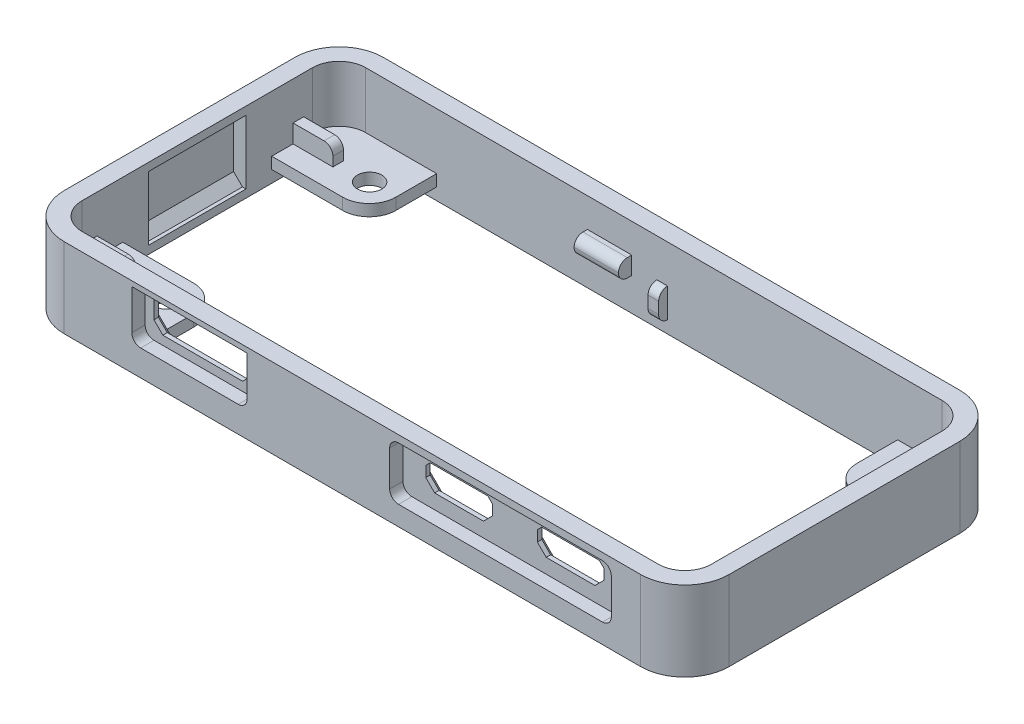
from build123d import *

# Parameters (mm, degrees)
EXTRUDE_1_DEPTH          = 7
EXTRUDE_1_DEPTH_BACK     = 2
CUT_EXTRUDE_2_DEPTH      = 44.557928135
CUT_EXTRUDE_2_DEPTH_BACK = 44.557928135
RIB_START                = -0.65
RIB_1_DEPTH              = 1.3
RIB_2_DEPTH              = 1.3
RIB_3_DEPTH              = 1.3
RIB_4_DEPTH              = 1.3
CUT_EXTRUDE_5_DEPTH      = 40
CUT_EXTRUDE_5_DEPTH_BACK = 40
SKETCH_18_R              = 1.375
SKETCH_41_W              = 13
SKETCH_41_H              = 5.5
CUT_EXTRUDE_14_DEPTH     = 1.5
SKETCH_53_W              = 1.2
SKETCH_53_H              = 3.3
EXTRUDE_15_DEPTH         = 1
FILLET_20_R              = 1
SKETCH_55_W              = 1.2
SKETCH_55_H              = 3.3
EXTRUDE_17_DEPTH         = 1.4
SKETCH_54_W              = 1.2
SKETCH_54_H              = 3.3
EXTRUDE_18_DEPTH         = 4.5
FILLET_22_R              = 1
SKETCH_59_W              = 11
SKETCH_59_H              = 7.2
CUT_EXTRUDE_24_DEPTH     = 1.4
CHAMFER_5_SIZE           = 1
SKETCH_63_W              = 1.2
SKETCH_63_H              = 3.3
EXTRUDE_21_DEPTH         = 4.5
FILLET_27_R              = 1
SKETCH_64_W              = 1.2
SKETCH_64_H              = 3.3
EXTRUDE_22_DEPTH         = 1.4
FILLET_28_R              = 1
SKETCH_65_W              = 1.2
SKETCH_65_H              = 3.3
EXTRUDE_23_DEPTH         = 0.9
FILLET_29_R              = 1
SKETCH_66_W              = 15
SKETCH_66_H              = 7.2
CUT_EXTRUDE_26_DEPTH     = 1.5
CHAMFER_10_SIZE          = 1
SKETCH_70_W              = 5
SKETCH_70_H              = 1.2
EXTRUDE_24_DEPTH         = 1.5
FILLET_31_R              = 1
SKETCH_71_W              = 5
SKETCH_71_H              = 2
EXTRUDE_25_DEPTH         = 1.5
FILLET_32_R              = 1
SKETCH_42_W              = 11
SKETCH_42_H              = 3.5
CUT_EXTRUDE_15_DEPTH     = 2.4
FILLET_33_R              = 1
SKETCH_74_W              = 16
SKETCH_74_H              = 6
EXTRUDE_26_DEPTH         = 0.5
CUT_EXTRUDE_29_REACH     = 55.566
SKETCH_46_W              = 11
SKETCH_46_H              = 3.5
CHAMFER_13_SIZE          = 1
FILLET_34_R              = 1
SKETCH_77_W              = 23.5
SKETCH_77_H              = 5
EXTRUDE_27_DEPTH         = 0.5
FILLET_39_R              = 1
CUT_EXTRUDE_31_REACH     = 55.566
SKETCH_50_W              = 7.5
SKETCH_50_H              = 2.7
CHAMFER_14_SIZE          = 1
CHAMFER_15_SIZE          = 0.5
CHAMFER_16_SIZE          = 0.5
SKETCH_78_W              = 25
SKETCH_78_H              = 6
CUT_EXTRUDE_32_DEPTH     = 1.5
FILLET_40_R              = 1


# Read off the part's stored shape, not the designer's step: 筋1, 筋2, 筋3, 筋4
# Some blends are built 0.0001 mm under size
with BuildPart() as part:
    # case 2 → 凸台-拉伸1 (new, two sides: drawn at the far end of the back side and taken through both)
    with BuildSketch(Plane(origin=(0, 0, 0), x_dir=(1, 0, 0), z_dir=(0, 1, 0)).offset(-EXTRUDE_1_DEPTH_BACK)):
        with BuildLine():
            Line((-34.042196447, 18), (30.957803553, 18))
            ThreePointArc((30.957803553, 18), (34.493337459, 16.535533906), (35.957803553, 13))
            Line((35.957803553, 13), (35.957803553, -13))
            ThreePointArc((35.957803553, -13), (34.493337459, -16.535533906), (30.957803553, -18))
            Line((30.957803553, -18), (-34.042196447, -18))
            ThreePointArc((-34.042196447, -18), (-37.577730353, -16.535533906), (-39.042196447, -13))
            Line((-39.042196447, -13), (-39.042196447, 13))
            ThreePointArc((-39.042196447, 13), (-37.577730353, 16.535533906), (-34.042196447, 18))
        make_face()
    extrude(amount=EXTRUDE_1_DEPTH + EXTRUDE_1_DEPTH_BACK)

    # 草图13 → 切除-拉伸2 (cut, two sides: drawn at the far end of the back side and taken through both)
    with BuildSketch(Plane(origin=(0, 0, 0), x_dir=(1, 0, 0), z_dir=(0, 1, 0)).offset(-CUT_EXTRUDE_2_DEPTH_BACK)):
        with BuildLine():
            Line((-34.042196447, -16), (30.957803553, -16))
            ThreePointArc((30.957803553, -16), (33.079123896, -15.121320344), (33.957803553, -13))
            Line((33.957803553, -13), (33.957803553, 13))
            ThreePointArc((33.957803553, 13), (33.079123896, 15.121320344), (30.957803553, 16))
            Line((30.957803553, 16), (-34.042196447, 16))
            ThreePointArc((-34.042196447, 16), (-36.163516791, 15.121320344), (-37.042196447, 13))
            Line((-37.042196447, 13), (-37.042196447, -13))
            ThreePointArc((-37.042196447, -13), (-36.163516791, -15.121320344), (-34.042196447, -16))
        make_face()
    extrude(amount=CUT_EXTRUDE_2_DEPTH + CUT_EXTRUDE_2_DEPTH_BACK, mode=Mode.SUBTRACT)

    # 筋1 outline → 筋1 (add)
    with BuildSketch(Plane(origin=(0, 0, 0), x_dir=(1, 0, 0), z_dir=(0, 1, 0)).offset(RIB_START)):
        with BuildLine():
            Line((-37.042196447, 8.4), (-29.042196447, 8.4))
            ThreePointArc((-29.042196447, 8.4), (-26.920876103, 9.278679657), (-26.042196447, 11.4))
            Line((-26.042196447, 11.4), (-26.042196447, 16))
            Line((-26.042196447, 16), (-34.042196447, 16))
            ThreePointArc((-34.042196447, 16), (-36.163516791, 15.121320344), (-37.042196447, 13))
            Line((-37.042196447, 13), (-37.042196447, 8.4))
        make_face()
    extrude(amount=RIB_1_DEPTH)

    # 筋2 outline → 筋2 (add)
    with BuildSketch(Plane(origin=(0, 0, 0), x_dir=(1, 0, 0), z_dir=(0, 1, 0)).offset(RIB_START)):
        with BuildLine():
            Line((-34.042196447, -16), (-26.042196447, -16))
            Line((-26.042196447, -16), (-26.042196447, -11.4))
            ThreePointArc((-26.042196447, -11.4), (-26.920876103, -9.278679657), (-29.042196447, -8.4))
            Line((-29.042196447, -8.4), (-37.042196447, -8.4))
            Line((-37.042196447, -8.4), (-37.042196447, -13))
            ThreePointArc((-37.042196447, -13), (-36.163516791, -15.121320344), (-34.042196447, -16))
        make_face()
    extrude(amount=RIB_2_DEPTH)

    # 筋3 outline → 筋3 (add)
    with BuildSketch(Plane(origin=(0, 0, 0), x_dir=(1, 0, 0), z_dir=(0, 1, 0)).offset(RIB_START)):
        with BuildLine():
            ThreePointArc((25.957803553, 11.4), (26.836483209, 9.278679656), (28.957803553, 8.4))
            Line((28.957803553, 8.4), (33.957803553, 8.4))
            Line((33.957803553, 8.4), (33.957803553, 13))
            ThreePointArc((33.957803553, 13), (33.079123897, 15.121320343), (30.957803553, 16))
            Line((30.957803553, 16), (25.957803553, 16))
            Line((25.957803553, 16), (25.957803553, 11.4))
        make_face()
    extrude(amount=RIB_3_DEPTH)

    # 筋4 outline → 筋4 (add)
    with BuildSketch(Plane(origin=(0, 0, 0), x_dir=(1, 0, 0), z_dir=(0, 1, 0)).offset(RIB_START)):
        with BuildLine():
            Line((33.957803553, -13), (33.957803553, -8.4))
            Line((33.957803553, -8.4), (28.957803553, -8.4))
            ThreePointArc((28.957803553, -8.4), (26.836483209, -9.278679656), (25.957803553, -11.4))
            Line((25.957803553, -11.4), (25.957803553, -16))
            Line((25.957803553, -16), (30.957803553, -16))
            ThreePointArc((30.957803553, -16), (33.079123897, -15.121320343), (33.957803553, -13))
        make_face()
    extrude(amount=RIB_4_DEPTH)

    # 草图18 → 切除-拉伸5 (cut, two sides: drawn at the far end of the back side and taken through both)
    with BuildSketch(Plane(origin=(0, 0, 0), x_dir=(1, 0, 0), z_dir=(0, 1, 0)).offset(-CUT_EXTRUDE_5_DEPTH_BACK)):
        with Locations(Location((-29, 11.4, 0), (0, 0, 270))):
            Circle(SKETCH_18_R)
        with Locations(Location((-29, -11.5, 0), (0, 0, 270))):
            Circle(SKETCH_18_R)
        with Locations(Location((29, 11.4, 0), (0, 0, 270))):
            Circle(SKETCH_18_R)
        with Locations(Location((29, -11.5, 0), (0, 0, 270))):
            Circle(SKETCH_18_R)
    extrude(amount=CUT_EXTRUDE_5_DEPTH + CUT_EXTRUDE_5_DEPTH_BACK, mode=Mode.SUBTRACT)

    # 草图41 → 切除-拉伸14 (cut)
    with BuildSketch(Plane.XY.offset(18)):
        with Locations((-19.922149827, 3.68)):
            Rectangle(SKETCH_41_W, SKETCH_41_H)
    extrude(amount=-CUT_EXTRUDE_14_DEPTH, mode=Mode.SUBTRACT)

    # 草图53 → 凸台-拉伸15 (add)
    with BuildSketch(Plane.XY.offset(-16)):
        with Locations((-0.6, 1.05)):
            Rectangle(SKETCH_53_W, SKETCH_53_H)
    extrude(amount=EXTRUDE_15_DEPTH)

    # 圆角20
    fillet_20_edges = [part.edges().sort_by_distance(p)[0] for p in [
        (-0.6, -0.6, -15),
        (-0.6, 2.7, -15),
    ]]
    fillet(fillet_20_edges, radius=FILLET_20_R - 0.0001)  # a hair under: the kernel refuses the full size

    # 草图55 → 凸台-拉伸17 (add)
    with BuildSketch(Plane.ZY.offset(-33.957803553)):
        with Locations((-11.4, 1.05)):
            Rectangle(SKETCH_55_W, SKETCH_55_H)
    extrude(amount=EXTRUDE_17_DEPTH)

    # 草图54 → 凸台-拉伸18 (add)
    with BuildSketch(Plane(origin=(-37.042196447, 0, 0), x_dir=(0, 0, -1), z_dir=(1, 0, 0))):
        with Locations((11.4, 1.05)):
            Rectangle(SKETCH_54_W, SKETCH_54_H)
    extrude(amount=EXTRUDE_18_DEPTH)

    # 圆角22
    fillet_22_edges = [part.edges().sort_by_distance(p)[0] for p in [
        (32.557803553, 2.7, -11.4),
        (-32.542196447, 2.7, -11.4),
    ]]
    fillet(fillet_22_edges, radius=FILLET_22_R)

    # 草图59 → 切除-拉伸24 (cut)
    with BuildSketch(Plane(origin=(-37.042196447, 0, 0), x_dir=(0, 0, -1), z_dir=(1, 0, 0))):
        with Locations((0, 2.5)):
            Rectangle(SKETCH_59_W, SKETCH_59_H)
    extrude(amount=-CUT_EXTRUDE_24_DEPTH, mode=Mode.SUBTRACT)

    # 倒角5
    chamfer_5_edges = [part.edges().sort_by_distance(p)[0] for p in [
        (-38.442196447, -1.1, 0),
        (-38.442196447, 6.1, 0),
    ]]
    chamfer(chamfer_5_edges, length=CHAMFER_5_SIZE)

    # 草图63 → 凸台-拉伸21 (add)
    with BuildSketch(Plane(origin=(-37.042196447, 0, 0), x_dir=(0, 0, -1), z_dir=(1, 0, 0))):
        with Locations((-11.9, 1.05)):
            Rectangle(SKETCH_63_W, SKETCH_63_H)
    extrude(amount=EXTRUDE_21_DEPTH)

    # 圆角27
    fillet_27_edges = [part.edges().sort_by_distance(p)[0] for p in [
        (-32.542196447, 2.7, 11.9),
    ]]
    fillet(fillet_27_edges, radius=FILLET_27_R)

    # 草图64 → 凸台-拉伸22 (add)
    with BuildSketch(Plane.ZY.offset(-33.957803553)):
        with Locations((11.9, 1.05)):
            Rectangle(SKETCH_64_W, SKETCH_64_H)
    extrude(amount=EXTRUDE_22_DEPTH)

    # 圆角28
    fillet_28_edges = [part.edges().sort_by_distance(p)[0] for p in [
        (32.557803553, 2.7, 11.9),
    ]]
    fillet(fillet_28_edges, radius=FILLET_28_R)

    # 草图65 → 凸台-拉伸23 (add)
    with BuildSketch(Plane(origin=(0, 0, 16), x_dir=(-1, 0, 0), z_dir=(0, 0, -1))):
        with Locations((0.6, 1.05)):
            Rectangle(SKETCH_65_W, SKETCH_65_H)
    extrude(amount=EXTRUDE_23_DEPTH)

    # 圆角29
    # the kernel refuses this fillet: 1 mm, written as the material it takes off along each edge
    with BuildSketch(Plane(origin=(2.487468593, -0.6, 15.1), x_dir=(0, 0, 1), z_dir=(-1, 0, 0)), Plane(origin=(-3.687468593, 2.7, 15.1), x_dir=(0, 0, 1), z_dir=(1, 0, 0))) as fillet_29_piece_1:
        with BuildLine():
            CenterArc((1, 0.994987437), FILLET_29_R, 180, 84.260829523)
            Line((0, 0.994987437), (-0.02, 0.994987437))
            Line((-0.02, 0.994987437), (-0.02, 0))
            Line((-0.02, 0), (0, -0.02))
            ThreePointArc((0, -0.02), (0.45, -0.02), (0.898, -0.019899749))
            Line((0.898, -0.019899749), (0.9, 0))
        make_face()
    extrude(amount=6.174937186, mode=Mode.SUBTRACT)

    # 草图66 → 切除-拉伸26 (cut)
    with BuildSketch(Plane.ZY.offset(-33.957803553)):
        with Locations((0, 2.5)):
            Rectangle(SKETCH_66_W, SKETCH_66_H)
    extrude(amount=-CUT_EXTRUDE_26_DEPTH, mode=Mode.SUBTRACT)

    # 倒角10
    chamfer_10_edges = [part.edges().sort_by_distance(p)[0] for p in [
        (35.457803553, -1.1, 0),
        (35.457803553, 6.1, 0),
    ]]
    chamfer(chamfer_10_edges, length=CHAMFER_10_SIZE)

    # 草图70 → 凸台-拉伸24 (add)
    with BuildSketch(Plane(origin=(0, 0, 16), x_dir=(-1, 0, 0), z_dir=(0, 0, -1))):
        with Locations((6.542196447, 2.45)):
            Rectangle(SKETCH_70_W, SKETCH_70_H)
    extrude(amount=EXTRUDE_24_DEPTH)

    # 圆角31
    fillet_31_edges = [part.edges().sort_by_distance(p)[0] for p in [
        (-6.542196447, 3.05, 14.5),
    ]]
    fillet(fillet_31_edges, radius=FILLET_31_R)

    # 草图71 → 凸台-拉伸25 (add)
    with BuildSketch(Plane.XY.offset(-16)):
        with Locations((-6.537335394, 2.7)):
            Rectangle(SKETCH_71_W, SKETCH_71_H)
    extrude(amount=EXTRUDE_25_DEPTH)

    # 圆角32
    fillet_32_edges = [part.edges().sort_by_distance(p)[0] for p in [
        (-6.537335394, 1.7, -14.5),
        (-6.537335394, 3.7, -14.5),
    ]]
    fillet(fillet_32_edges, radius=FILLET_32_R - 0.0001)  # a hair under: the kernel refuses the full size

    # 草图42 → 切除-拉伸15 (cut)
    with BuildSketch(Plane.XY.offset(18)):
        with Locations((-19.922149827, 3.68)):
            Rectangle(SKETCH_42_W, SKETCH_42_H)
    extrude(amount=-CUT_EXTRUDE_15_DEPTH, mode=Mode.SUBTRACT)

    # 圆角33
    fillet_33_edges = [part.edges().sort_by_distance(p)[0] for p in [
        (-13.422149827, 0.93, 17.25),
        (-26.422149827, 0.93, 17.25),
    ]]
    fillet(fillet_33_edges, radius=FILLET_33_R)

    # 草图74 → 凸台-拉伸26 (add)
    with BuildSketch(Plane(origin=(0, 0, 16), x_dir=(-1, 0, 0), z_dir=(0, 0, -1))):
        with Locations((20.042196447, 2.9)):
            Rectangle(SKETCH_74_W, SKETCH_74_H)
    extrude(amount=EXTRUDE_26_DEPTH)

    # 草图46 → 切除-拉伸29 (cut, up to next)
    with BuildSketch(Plane.XY.offset(18), mode=Mode.PRIVATE) as cut_extrude_29_sk1:
        with Locations((-19.922149827, 3.68)):
            Rectangle(SKETCH_46_W, SKETCH_46_H)
    cut_extrude_29_tool1 = extrude(cut_extrude_29_sk1.sketch, amount=-CUT_EXTRUDE_29_REACH, mode=Mode.PRIVATE) & part.part
    add(cut_extrude_29_tool1.solids().sort_by_distance((-19.92215, 3.68, 18))[0], mode=Mode.SUBTRACT)

    # 倒角13
    chamfer_13_edges = [part.edges().sort_by_distance(p)[0] for p in [
        (-25.422149827, 1.93, 16),
        (-14.422149827, 1.93, 16),
    ]]
    chamfer(chamfer_13_edges, length=CHAMFER_13_SIZE)

    # 圆角34
    fillet_34_edges = [part.edges().sort_by_distance(p)[0] for p in [
        (-12.042196447, -0.1, 15.75),
    ]]
    fillet(fillet_34_edges, radius=FILLET_34_R)

    # 草图77 → 凸台-拉伸27 (add)
    with BuildSketch(Plane(origin=(0, 0, 16), x_dir=(-1, 0, 0), z_dir=(0, 0, -1))):
        with Locations((-15.207803553, 3.4)):
            Rectangle(SKETCH_77_W, SKETCH_77_H)
    extrude(amount=EXTRUDE_27_DEPTH)

    # 圆角39
    fillet_39_edges = [part.edges().sort_by_distance(p)[0] for p in [
        (26.957803553, 0.9, 15.75),
        (3.457803553, 0.9, 15.75),
    ]]
    fillet(fillet_39_edges, radius=FILLET_39_R)

    # 草图50 → 切除-拉伸31 (cut, up to next)
    with BuildSketch(Plane.XY.offset(18), mode=Mode.PRIVATE) as cut_extrude_31_sk1:
        with Locations((21.563738428, 3.198192542)):
            Rectangle(SKETCH_50_W, SKETCH_50_H)
    cut_extrude_31_tool1 = extrude(cut_extrude_31_sk1.sketch, amount=-CUT_EXTRUDE_31_REACH, mode=Mode.PRIVATE) & part.part
    # 草图50 → 切除-拉伸31 (cut, up to next)
    with BuildSketch(Plane.XY.offset(18), mode=Mode.PRIVATE) as cut_extrude_31_sk2:
        with Locations((8.984862183, 3.198192542)):
            Rectangle(SKETCH_50_W, SKETCH_50_H)
    cut_extrude_31_tool2 = extrude(cut_extrude_31_sk2.sketch, amount=-CUT_EXTRUDE_31_REACH, mode=Mode.PRIVATE) & part.part
    add(cut_extrude_31_tool1.solids().sort_by_distance((21.563738, 3.198193, 18))[0], mode=Mode.SUBTRACT)
    add(cut_extrude_31_tool2.solids().sort_by_distance((8.984862, 3.198193, 18))[0], mode=Mode.SUBTRACT)

    # 倒角14
    chamfer_14_edges = [part.edges().sort_by_distance(p)[0] for p in [
        (17.813738428, 1.848192542, 16.75),
        (25.313738428, 1.848192542, 16.75),
        (12.734862183, 1.848192542, 16.75),
        (5.234862183, 1.848192542, 16.75),
    ]]
    chamfer(chamfer_14_edges, length=CHAMFER_14_SIZE)

    # 倒角15
    chamfer_15_edges = [part.edges().sort_by_distance(p)[0] for p in [
        (25.313738428, 4.548192542, 16.75),
        (17.813738428, 4.548192542, 16.75),
        (12.734862183, 4.548192542, 16.75),
        (5.234862183, 4.548192542, 16.75),
    ]]
    chamfer(chamfer_15_edges, length=CHAMFER_15_SIZE)

    # 倒角16
    chamfer_16_edges = [part.edges().sort_by_distance(p)[0] for p in [
        (25.313738428, 3.448192542, 15.5),
        (21.563738428, 1.848192542, 15.5),
        (12.734862183, 3.448192542, 15.5),
        (8.984862183, 1.848192542, 15.5),
        (24.813738428, 2.348192542, 15.5),
        (18.313738428, 2.348192542, 15.5),
        (12.234862183, 2.348192542, 15.5),
        (5.734862183, 2.348192542, 15.5),
        (21.563738428, 4.548192542, 15.5),
        (17.813738428, 3.448192542, 15.5),
        (8.984862183, 4.548192542, 15.5),
        (5.234862183, 3.448192542, 15.5),
        (25.063738428, 4.298192542, 15.5),
        (18.063738428, 4.298192542, 15.5),
        (12.484862183, 4.298192542, 15.5),
        (5.484862183, 4.298192542, 15.5),
    ]]
    chamfer(chamfer_16_edges, length=CHAMFER_16_SIZE)

    # 草图78 → 切除-拉伸32 (cut)
    with BuildSketch(Plane.XY.offset(18)):
        with Locations((15.157803553, 3.2)):
            Rectangle(SKETCH_78_W, SKETCH_78_H)
    extrude(amount=-CUT_EXTRUDE_32_DEPTH, mode=Mode.SUBTRACT)

    # 圆角40
    fillet_40_edges = [part.edges().sort_by_distance(p)[0] for p in [
        (2.657803553, 0.2, 17.25),
        (2.657803553, 6.2, 17.25),
        (27.657803553, 6.2, 17.25),
        (27.657803553, 0.2, 17.25),
    ]]
    fillet(fillet_40_edges, radius=FILLET_40_R)

    # 倒角17
    # the kernel refuses this chamfer: 0.5 mm, written as the material it takes off along each edge
    with BuildSketch(Plane(origin=(-25.422149827, 5.43, 15.5), x_dir=(0, -0.02749587661058555, 0.9996219169112968), z_dir=(1, 0, 0))) as chamfer_17_piece_1:
        with BuildLine():
            Line((0.514336598, 0), (-0.028273577, -0.513558897))
            Line((-0.028273577, -0.513558897), (-0.038269797, -0.513283938))
            ThreePointArc((-0.038269797, -0.513283938), (-0.017064614, -0.256698915), (-0.009996219, 0.000274959))
            Line((-0.009996219, 0.000274959), (0.000274959, 0.009996219))
            ThreePointArc((0.000274959, 0.009996219), (0.257248832, 0.002927825), (0.514611556, 0.009996219))
            Line((0.514611556, 0.009996219), (0.514336598, 0))
        make_face()
    extrude(amount=11, mode=Mode.SUBTRACT)
    with BuildSketch(Plane(origin=(-25.422149827, 1.644158506, 15.5), x_dir=(0.0274958766105891, 0, 0.9996219169112968), z_dir=(0, 1, 0))) as chamfer_17_piece_2_section:
        with BuildLine():
            Line((0.514336598, 0), (-0.028273577, -0.513558897))
            Line((-0.028273577, -0.513558897), (-0.038269797, -0.513283938))
            ThreePointArc((-0.038269797, -0.513283938), (-0.017064614, -0.256698915), (-0.009996219, 0.000274959))
            Line((-0.009996219, 0.000274959), (0.000274959, 0.009996219))
            ThreePointArc((0.000274959, 0.009996219), (0.257248832, 0.002927825), (0.514611556, 0.009996219))
            Line((0.514611556, 0.009996219), (0.514336598, 0))
        make_face()
    chamfer_17_piece_2 = extrude(amount=3.785841494, mode=Mode.PRIVATE)
    chamfer_17_piece_2 = split(chamfer_17_piece_2, bisect_by=Plane(origin=(-26.165723422, 3.673573595, 15.668531421), z_dir=(0.7071067811865476, 0.7071067811865476, 0)), keep=Keep.TOP, mode=Mode.PRIVATE)
    add(chamfer_17_piece_2, mode=Mode.SUBTRACT)
    with BuildSketch(Plane(origin=(-14.422149827, 5.43, 15.5), x_dir=(-0.02749587661058555, 0, 0.9996219169112968), z_dir=(0, -1, 0))) as chamfer_17_piece_3_section:
        with BuildLine():
            Line((0.514336598, 0), (-0.028273577, -0.513558897))
            Line((-0.028273577, -0.513558897), (-0.038269797, -0.513283938))
            ThreePointArc((-0.038269797, -0.513283938), (-0.017064614, -0.256698915), (-0.009996219, 0.000274959))
            Line((-0.009996219, 0.000274959), (0.000274959, 0.009996219))
            ThreePointArc((0.000274959, 0.009996219), (0.257248832, 0.002927825), (0.514611556, 0.009996219))
            Line((0.514611556, 0.009996219), (0.514336598, 0))
        make_face()
    chamfer_17_piece_3 = extrude(amount=3.785841494, mode=Mode.PRIVATE)
    chamfer_17_piece_3 = split(chamfer_17_piece_3, bisect_by=Plane(origin=(-13.678576232, 3.673573595, 15.668531421), z_dir=(-0.7071067811865477, 0.7071067811865474, 0)), keep=Keep.TOP, mode=Mode.PRIVATE)
    add(chamfer_17_piece_3, mode=Mode.SUBTRACT)
    with BuildSketch(Plane(origin=(-14.136308333, 1.93, 15.5), x_dir=(0, 0.02749587661058651, 0.9996219169112968), z_dir=(-1, 0, 0))) as chamfer_17_piece_4_section:
        with BuildLine():
            Line((0.514336598, 0), (-0.028273577, -0.513558897))
            Line((-0.028273577, -0.513558897), (-0.038269797, -0.513283938))
            ThreePointArc((-0.038269797, -0.513283938), (-0.017064614, -0.256698915), (-0.009996219, 0.000274959))
            Line((-0.009996219, 0.000274959), (0.000274959, 0.009996219))
            ThreePointArc((0.000274959, 0.009996219), (0.257248832, 0.002927825), (0.514611556, 0.009996219))
            Line((0.514611556, 0.009996219), (0.514336598, 0))
        make_face()
    chamfer_17_piece_4 = extrude(amount=11.571682988, mode=Mode.PRIVATE)
    chamfer_17_piece_4 = split(chamfer_17_piece_4, bisect_by=Plane(origin=(-22.091532477, -0.40061735, 15.666854595), z_dir=(0.7071067811865476, 0.7071067811865476, 0)), keep=Keep.TOP, mode=Mode.PRIVATE)
    chamfer_17_piece_4 = split(chamfer_17_piece_4, bisect_by=Plane(origin=(-17.752767178, -0.40061735, 15.666854595), z_dir=(-0.7071067811865477, 0.7071067811865474, 0)), keep=Keep.TOP, mode=Mode.PRIVATE)
    add(chamfer_17_piece_4, mode=Mode.SUBTRACT)
    with BuildSketch(Plane(origin=(-16.331377067, 1.02077276, 15.5), x_dir=(-0.01944252080601473, 0.019442520806014614, 0.9996219169112968), z_dir=(0.7071067811865474, 0.7071067811865477, 0))) as chamfer_17_piece_5_section:
        with BuildLine():
            Line((0.514336598, 0), (-0.028273577, 0.513558897))
            Line((-0.028273577, 0.513558897), (-0.038269797, 0.513283938))
            ThreePointArc((-0.038269797, 0.513283938), (-0.017064614, 0.256698915), (-0.009996219, -0.000274959))
            Line((-0.009996219, -0.000274959), (0.000274959, -0.009996219))
            ThreePointArc((0.000274959, -0.009996219), (0.257248832, -0.002927825), (0.514611556, -0.009996219))
            Line((0.514611556, -0.009996219), (0.514336598, 0))
        make_face()
    chamfer_17_piece_5 = extrude(amount=3.98589655, mode=Mode.PRIVATE)
    chamfer_17_piece_5 = split(chamfer_17_piece_5, bisect_by=Plane(origin=(-14.826253904, 1.93, 15.680549759), z_dir=(0, 1, 0)), keep=Keep.TOP, mode=Mode.PRIVATE)
    chamfer_17_piece_5 = split(chamfer_17_piece_5, bisect_by=Plane(origin=(-14.422149827, 2.334104077, 15.680549759), z_dir=(-1, 0, 0)), keep=Keep.TOP, mode=Mode.PRIVATE)
    add(chamfer_17_piece_5, mode=Mode.SUBTRACT)
    with BuildSketch(Plane(origin=(-23.512922587, 1.02077276, 15.5), x_dir=(0.019442520806014184, 0.01944252080601429, 0.9996219169112968), z_dir=(-0.7071067811865476, 0.7071067811865476, 0))) as chamfer_17_piece_6_section:
        with BuildLine():
            Line((0.514336598, 0), (-0.028273577, -0.513558897))
            Line((-0.028273577, -0.513558897), (-0.038269797, -0.513283938))
            ThreePointArc((-0.038269797, -0.513283938), (-0.017064614, -0.256698915), (-0.009996219, 0.000274959))
            Line((-0.009996219, 0.000274959), (0.000274959, 0.009996219))
            ThreePointArc((0.000274959, 0.009996219), (0.257248832, 0.002927825), (0.514611556, 0.009996219))
            Line((0.514611556, 0.009996219), (0.514336598, 0))
        make_face()
    chamfer_17_piece_6 = extrude(amount=3.98589655, mode=Mode.PRIVATE)
    chamfer_17_piece_6 = split(chamfer_17_piece_6, bisect_by=Plane(origin=(-25.422149827, 2.334104077, 15.680549759), z_dir=(1, 0, 0)), keep=Keep.TOP, mode=Mode.PRIVATE)
    chamfer_17_piece_6 = split(chamfer_17_piece_6, bisect_by=Plane(origin=(-25.01804575, 1.93, 15.680549759), z_dir=(0, 1, 0)), keep=Keep.TOP, mode=Mode.PRIVATE)
    add(chamfer_17_piece_6, mode=Mode.SUBTRACT)
    with BuildSketch(Plane(origin=(-25.422149827, 1.644158506, 15.5), x_dir=(0.0274958766105891, 0, 0.9996219169112968), z_dir=(0, 1, 0))) as chamfer_17_piece_7a_section:
        with BuildLine():
            Line((0.514336598, 0), (-0.028273577, -0.513558897))
            Line((-0.028273577, -0.513558897), (-0.038269797, -0.513283938))
            ThreePointArc((-0.038269797, -0.513283938), (-0.017064614, -0.256698915), (-0.009996219, 0.000274959))
            Line((-0.009996219, 0.000274959), (0.000274959, 0.009996219))
            ThreePointArc((0.000274959, 0.009996219), (0.257248832, 0.002927825), (0.514611556, 0.009996219))
            Line((0.514611556, 0.009996219), (0.514336598, 0))
        make_face()
    chamfer_17_piece_7a = extrude(amount=5.071682988, mode=Mode.PRIVATE)
    chamfer_17_piece_7a = split(chamfer_17_piece_7a, bisect_by=Plane(origin=(-25.587046641, 5.43, 15.664896813), z_dir=(0, 1, 0)), keep=Keep.TOP, mode=Mode.PRIVATE)
    with BuildSketch(Plane(origin=(-26.707991321, 5.43, 15.5), x_dir=(0, -0.027495876610585647, 0.9996219169112968), z_dir=(1, 0, 0))) as chamfer_17_piece_7b_section:
        with BuildLine():
            Line((0.514336598, 0), (-0.028273577, -0.513558897))
            Line((-0.028273577, -0.513558897), (-0.038269797, -0.513283938))
            ThreePointArc((-0.038269797, -0.513283938), (-0.017064614, -0.256698915), (-0.009996219, 0.000274959))
            Line((-0.009996219, 0.000274959), (0.000274959, 0.009996219))
            ThreePointArc((0.000274959, 0.009996219), (0.257248832, 0.002927825), (0.514611556, 0.009996219))
            Line((0.514611556, 0.009996219), (0.514336598, 0))
        make_face()
    chamfer_17_piece_7b = extrude(amount=12.285841494, mode=Mode.PRIVATE)
    chamfer_17_piece_7b = split(chamfer_17_piece_7b, bisect_by=Plane(origin=(-25.422149827, 5.594896813, 15.664896813), z_dir=(-1, 0, 0)), keep=Keep.TOP, mode=Mode.PRIVATE)
    chamfer_17_piece_7 = chamfer_17_piece_7a & chamfer_17_piece_7b
    add(chamfer_17_piece_7, mode=Mode.SUBTRACT)
    with BuildSketch(Plane(origin=(-25.422149827, 5.43, 15.5), x_dir=(0, -0.02749587661058555, 0.9996219169112968), z_dir=(1, 0, 0))) as chamfer_17_piece_8a_section:
        with BuildLine():
            Line((0.514336598, 0), (-0.028273577, -0.513558897))
            Line((-0.028273577, -0.513558897), (-0.038269797, -0.513283938))
            ThreePointArc((-0.038269797, -0.513283938), (-0.017064614, -0.256698915), (-0.009996219, 0.000274959))
            Line((-0.009996219, 0.000274959), (0.000274959, 0.009996219))
            ThreePointArc((0.000274959, 0.009996219), (0.257248832, 0.002927825), (0.514611556, 0.009996219))
            Line((0.514611556, 0.009996219), (0.514336598, 0))
        make_face()
    chamfer_17_piece_8a = extrude(amount=12.285841494, mode=Mode.PRIVATE)
    chamfer_17_piece_8a = split(chamfer_17_piece_8a, bisect_by=Plane(origin=(-14.422149827, 5.594896813, 15.664896813), z_dir=(1, 0, 0)), keep=Keep.TOP, mode=Mode.PRIVATE)
    with BuildSketch(Plane(origin=(-14.422149827, 6.715841494, 15.5), x_dir=(-0.027495876610585647, 0, 0.9996219169112968), z_dir=(0, -1, 0))) as chamfer_17_piece_8b_section:
        with BuildLine():
            Line((0.514336598, 0), (-0.028273577, -0.513558897))
            Line((-0.028273577, -0.513558897), (-0.038269797, -0.513283938))
            ThreePointArc((-0.038269797, -0.513283938), (-0.017064614, -0.256698915), (-0.009996219, 0.000274959))
            Line((-0.009996219, 0.000274959), (0.000274959, 0.009996219))
            ThreePointArc((0.000274959, 0.009996219), (0.257248832, 0.002927825), (0.514611556, 0.009996219))
            Line((0.514611556, 0.009996219), (0.514336598, 0))
        make_face()
    chamfer_17_piece_8b = extrude(amount=5.071682988, mode=Mode.PRIVATE)
    chamfer_17_piece_8b = split(chamfer_17_piece_8b, bisect_by=Plane(origin=(-14.257253014, 5.43, 15.664896813), z_dir=(0, 1, 0)), keep=Keep.TOP, mode=Mode.PRIVATE)
    chamfer_17_piece_8 = chamfer_17_piece_8a & chamfer_17_piece_8b
    add(chamfer_17_piece_8, mode=Mode.SUBTRACT)
    with BuildSketch(Plane(origin=(-25.422149827, 1.644158506, 15.5), x_dir=(0.0274958766105891, 0, 0.9996219169112968), z_dir=(0, 1, 0))) as chamfer_17_piece_9a_section:
        with BuildLine():
            Line((0.514336598, 0), (-0.028273577, -0.513558897))
            Line((-0.028273577, -0.513558897), (-0.038269797, -0.513283938))
            ThreePointArc((-0.038269797, -0.513283938), (-0.017064614, -0.256698915), (-0.009996219, 0.000274959))
            Line((-0.009996219, 0.000274959), (0.000274959, 0.009996219))
            ThreePointArc((0.000274959, 0.009996219), (0.257248832, 0.002927825), (0.514611556, 0.009996219))
            Line((0.514611556, 0.009996219), (0.514336598, 0))
        make_face()
    chamfer_17_piece_9a = extrude(amount=3.785841494, mode=Mode.PRIVATE)
    chamfer_17_piece_9a = split(chamfer_17_piece_9a, bisect_by=Plane(origin=(-25.232569421, 2.740419593, 15.659046562), z_dir=(-0.7071067811865476, -0.7071067811865476, 0)), keep=Keep.TOP, mode=Mode.PRIVATE)
    with BuildSketch(Plane(origin=(-23.512922587, 1.02077276, 15.5), x_dir=(0.019442520806014184, 0.01944252080601429, 0.9996219169112968), z_dir=(-0.7071067811865476, 0.7071067811865476, 0))) as chamfer_17_piece_9b_section:
        with BuildLine():
            Line((0.514336598, 0), (-0.028273577, -0.513558897))
            Line((-0.028273577, -0.513558897), (-0.038269797, -0.513283938))
            ThreePointArc((-0.038269797, -0.513283938), (-0.017064614, -0.256698915), (-0.009996219, 0.000274959))
            Line((-0.009996219, 0.000274959), (0.000274959, 0.009996219))
            ThreePointArc((0.000274959, 0.009996219), (0.257248832, 0.002927825), (0.514611556, 0.009996219))
            Line((0.514611556, 0.009996219), (0.514336598, 0))
        make_face()
    chamfer_17_piece_9b = extrude(amount=3.98589655, mode=Mode.PRIVATE)
    chamfer_17_piece_9b = split(chamfer_17_piece_9b, bisect_by=Plane(origin=(-25.422149827, 3.198107182, 15.659046562), z_dir=(-1, 0, 0)), keep=Keep.TOP, mode=Mode.PRIVATE)
    chamfer_17_piece_9 = chamfer_17_piece_9a & chamfer_17_piece_9b
    add(chamfer_17_piece_9, mode=Mode.SUBTRACT)
    with BuildSketch(Plane(origin=(-14.422149827, 5.43, 15.5), x_dir=(-0.02749587661058555, 0, 0.9996219169112968), z_dir=(0, -1, 0))) as chamfer_17_piece_10a_section:
        with BuildLine():
            Line((0.514336598, 0), (-0.028273577, -0.513558897))
            Line((-0.028273577, -0.513558897), (-0.038269797, -0.513283938))
            ThreePointArc((-0.038269797, -0.513283938), (-0.017064614, -0.256698915), (-0.009996219, 0.000274959))
            Line((-0.009996219, 0.000274959), (0.000274959, 0.009996219))
            ThreePointArc((0.000274959, 0.009996219), (0.257248832, 0.002927825), (0.514611556, 0.009996219))
            Line((0.514611556, 0.009996219), (0.514336598, 0))
        make_face()
    chamfer_17_piece_10a = extrude(amount=3.785841494, mode=Mode.PRIVATE)
    chamfer_17_piece_10a = split(chamfer_17_piece_10a, bisect_by=Plane(origin=(-14.611730234, 2.740419593, 15.659046562), z_dir=(0.7071067811865477, -0.7071067811865474, 0)), keep=Keep.TOP, mode=Mode.PRIVATE)
    with BuildSketch(Plane(origin=(-16.331377067, 1.02077276, 15.5), x_dir=(-0.01944252080601473, 0.019442520806014614, 0.9996219169112968), z_dir=(0.7071067811865474, 0.7071067811865477, 0))) as chamfer_17_piece_10b_section:
        with BuildLine():
            Line((0.514336598, 0), (-0.028273577, 0.513558897))
            Line((-0.028273577, 0.513558897), (-0.038269797, 0.513283938))
            ThreePointArc((-0.038269797, 0.513283938), (-0.017064614, 0.256698915), (-0.009996219, -0.000274959))
            Line((-0.009996219, -0.000274959), (0.000274959, -0.009996219))
            ThreePointArc((0.000274959, -0.009996219), (0.257248832, -0.002927825), (0.514611556, -0.009996219))
            Line((0.514611556, -0.009996219), (0.514336598, 0))
        make_face()
    chamfer_17_piece_10b = extrude(amount=3.98589655, mode=Mode.PRIVATE)
    chamfer_17_piece_10b = split(chamfer_17_piece_10b, bisect_by=Plane(origin=(-14.422149827, 3.198107182, 15.659046562), z_dir=(1, 0, 0)), keep=Keep.TOP, mode=Mode.PRIVATE)
    chamfer_17_piece_10 = chamfer_17_piece_10a & chamfer_17_piece_10b
    add(chamfer_17_piece_10, mode=Mode.SUBTRACT)
    with BuildSketch(Plane(origin=(-14.136308333, 1.93, 15.5), x_dir=(0, 0.02749587661058651, 0.9996219169112968), z_dir=(-1, 0, 0))) as chamfer_17_piece_11a_section:
        with BuildLine():
            Line((0.514336598, 0), (-0.028273577, -0.513558897))
            Line((-0.028273577, -0.513558897), (-0.038269797, -0.513283938))
            ThreePointArc((-0.038269797, -0.513283938), (-0.017064614, -0.256698915), (-0.009996219, 0.000274959))
            Line((-0.009996219, 0.000274959), (0.000274959, 0.009996219))
            ThreePointArc((0.000274959, 0.009996219), (0.257248832, 0.002927825), (0.514611556, 0.009996219))
            Line((0.514611556, 0.009996219), (0.514336598, 0))
        make_face()
    chamfer_17_piece_11a = extrude(amount=11.571682988, mode=Mode.PRIVATE)
    chamfer_17_piece_11a = split(chamfer_17_piece_11a, bisect_by=Plane(origin=(-15.232569421, 2.119580407, 15.659046562), z_dir=(0.7071067811865477, -0.7071067811865474, 0)), keep=Keep.TOP, mode=Mode.PRIVATE)
    with BuildSketch(Plane(origin=(-16.331377067, 1.02077276, 15.5), x_dir=(-0.01944252080601473, 0.019442520806014614, 0.9996219169112968), z_dir=(0.7071067811865474, 0.7071067811865477, 0))) as chamfer_17_piece_11b_section:
        with BuildLine():
            Line((0.514336598, 0), (-0.028273577, 0.513558897))
            Line((-0.028273577, 0.513558897), (-0.038269797, 0.513283938))
            ThreePointArc((-0.038269797, 0.513283938), (-0.017064614, 0.256698915), (-0.009996219, -0.000274959))
            Line((-0.009996219, -0.000274959), (0.000274959, -0.009996219))
            ThreePointArc((0.000274959, -0.009996219), (0.257248832, -0.002927825), (0.514611556, -0.009996219))
            Line((0.514611556, -0.009996219), (0.514336598, 0))
        make_face()
    chamfer_17_piece_11b = extrude(amount=3.98589655, mode=Mode.PRIVATE)
    chamfer_17_piece_11b = split(chamfer_17_piece_11b, bisect_by=Plane(origin=(-15.69025701, 1.93, 15.659046562), z_dir=(0, -1, 0)), keep=Keep.TOP, mode=Mode.PRIVATE)
    chamfer_17_piece_11 = chamfer_17_piece_11a & chamfer_17_piece_11b
    add(chamfer_17_piece_11, mode=Mode.SUBTRACT)
    with BuildSketch(Plane(origin=(-23.512922587, 1.02077276, 15.5), x_dir=(0.019442520806014184, 0.01944252080601429, 0.9996219169112968), z_dir=(-0.7071067811865476, 0.7071067811865476, 0))) as chamfer_17_piece_12a_section:
        with BuildLine():
            Line((0.514336598, 0), (-0.028273577, -0.513558897))
            Line((-0.028273577, -0.513558897), (-0.038269797, -0.513283938))
            ThreePointArc((-0.038269797, -0.513283938), (-0.017064614, -0.256698915), (-0.009996219, 0.000274959))
            Line((-0.009996219, 0.000274959), (0.000274959, 0.009996219))
            ThreePointArc((0.000274959, 0.009996219), (0.257248832, 0.002927825), (0.514611556, 0.009996219))
            Line((0.514611556, 0.009996219), (0.514336598, 0))
        make_face()
    chamfer_17_piece_12a = extrude(amount=3.98589655, mode=Mode.PRIVATE)
    chamfer_17_piece_12a = split(chamfer_17_piece_12a, bisect_by=Plane(origin=(-24.154042645, 1.93, 15.659046562), z_dir=(0, -1, 0)), keep=Keep.TOP, mode=Mode.PRIVATE)
    with BuildSketch(Plane(origin=(-14.136308333, 1.93, 15.5), x_dir=(0, 0.02749587661058651, 0.9996219169112968), z_dir=(-1, 0, 0))) as chamfer_17_piece_12b_section:
        with BuildLine():
            Line((0.514336598, 0), (-0.028273577, -0.513558897))
            Line((-0.028273577, -0.513558897), (-0.038269797, -0.513283938))
            ThreePointArc((-0.038269797, -0.513283938), (-0.017064614, -0.256698915), (-0.009996219, 0.000274959))
            Line((-0.009996219, 0.000274959), (0.000274959, 0.009996219))
            ThreePointArc((0.000274959, 0.009996219), (0.257248832, 0.002927825), (0.514611556, 0.009996219))
            Line((0.514611556, 0.009996219), (0.514336598, 0))
        make_face()
    chamfer_17_piece_12b = extrude(amount=11.571682988, mode=Mode.PRIVATE)
    chamfer_17_piece_12b = split(chamfer_17_piece_12b, bisect_by=Plane(origin=(-24.611730234, 2.119580407, 15.659046562), z_dir=(-0.7071067811865476, -0.7071067811865476, 0)), keep=Keep.TOP, mode=Mode.PRIVATE)
    chamfer_17_piece_12 = chamfer_17_piece_12a & chamfer_17_piece_12b
    add(chamfer_17_piece_12, mode=Mode.SUBTRACT)


solid = part.part
